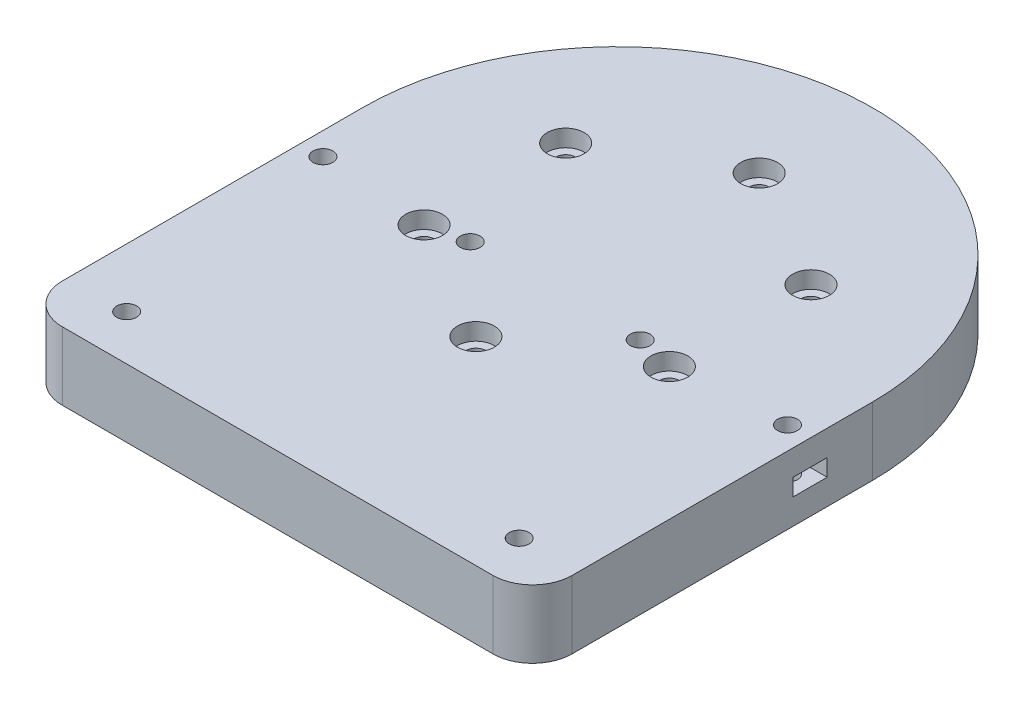
from build123d import *

# Parameters (mm, degrees)
SKETCH1_R               = 45
BOSS_EXTRUDE1_DEPTH     = 12
SKETCH2_R               = 31
CUT_EXTRUDE1_DEPTH      = 6
SKETCH3_R               = 1.75
CUT_EXTRUDE2_DEPTH      = 65.761099435
SKETCH4_R               = 3.25
CUT_EXTRUDE3_DEPTH      = 3
BOSS_EXTRUDE3_START     = -12
BOSS_EXTRUDE3_DEPTH     = 12
SKETCH7_R               = 1.75
CUT_EXTRUDE4_DEPTH      = 76.953933407
CUT_EXTRUDE5_DEPTH      = 3
CUT_EXTRUDE6_DEPTH      = 1.5
CUT_EXTRUDE6_DEPTH_BACK = 1.5
CUT_EXTRUDE7_DEPTH      = 6


with BuildPart() as part:
    # Sketch1 → Boss-Extrude1 (new body)
    with BuildSketch(Plane(origin=(0, 0, 0), x_dir=(1, 0, 0), z_dir=(0, 1, 0))):
        Circle(SKETCH1_R)
    extrude(amount=BOSS_EXTRUDE1_DEPTH)

    # Sketch2 → Cut-Extrude1 (cut)
    with BuildSketch(Plane.XZ):
        Circle(SKETCH2_R)
    extrude(amount=-CUT_EXTRUDE1_DEPTH, mode=Mode.SUBTRACT)

    # Sketch3 → Cut-Extrude2 (cut, through all)
    with BuildSketch(Plane(origin=(0, 12, 0), x_dir=(1, 0, 0), z_dir=(0, 1, 0))):
        with Locations((0, -25)):
            Circle(SKETCH3_R)
        with Locations((-21.650635095, -12.5)):
            Circle(SKETCH3_R)
        with Locations((-21.650635095, 12.5)):
            Circle(SKETCH3_R)
        with Locations((0, 25)):
            Circle(SKETCH3_R)
        with Locations((21.650635095, 12.5)):
            Circle(SKETCH3_R)
        with Locations((21.650635095, -12.5)):
            Circle(SKETCH3_R)
    extrude(amount=-CUT_EXTRUDE2_DEPTH, mode=Mode.SUBTRACT)

    # Sketch4 → Cut-Extrude3 (cut)
    with BuildSketch(Plane(origin=(0, 12, 0), x_dir=(1, 0, 0), z_dir=(0, 1, 0))):
        with Locations((0, 25)):
            Circle(SKETCH4_R)
        with Locations((21.650635095, 12.5)):
            Circle(SKETCH4_R)
        with Locations((21.650635095, -12.5)):
            Circle(SKETCH4_R)
        with Locations((0, -25)):
            Circle(SKETCH4_R)
        with Locations((-21.650635095, -12.5)):
            Circle(SKETCH4_R)
        with Locations((-21.650635095, 12.5)):
            Circle(SKETCH4_R)
    extrude(amount=-CUT_EXTRUDE3_DEPTH, mode=Mode.SUBTRACT)

    # Sketch5 → Boss-Extrude3 (add)
    with BuildSketch(Plane(origin=(0, 12, 0), x_dir=(1, 0, 0), z_dir=(0, 1, 0)).offset(BOSS_EXTRUDE3_START)):
        with BuildLine():
            ThreePointArc((45, 0), (0, -45), (-45, 0))
            Line((-45, 0), (-45, -53))
            ThreePointArc((-45, -53), (-42.949747468, -57.949747468), (-38, -60))
            Line((-38, -60), (38, -60))
            ThreePointArc((38, -60), (42.949747468, -57.949747468), (45, -53))
            Line((45, -53), (45, 0))
        make_face()
    extrude(amount=BOSS_EXTRUDE3_DEPTH)

    # Sketch7 → Cut-Extrude4 (cut, through all)
    with BuildSketch(Plane(origin=(0, 12, 0), x_dir=(1, 0, 0), z_dir=(0, 1, 0))):
        with Locations((-34.64, -52)):
            Circle(SKETCH7_R)
        with Locations((-41, -11)):
            Circle(SKETCH7_R)
        with Locations((-15, -11)):
            Circle(SKETCH7_R)
        with Locations((34.64, -52)):
            Circle(SKETCH7_R)
        with Locations((15, -11)):
            Circle(SKETCH7_R)
        with Locations((41, -11)):
            Circle(SKETCH7_R)
    extrude(amount=-CUT_EXTRUDE4_DEPTH, mode=Mode.SUBTRACT)

    # Sketch8 → Cut-Extrude5 (cut)
    with BuildSketch(Plane.XZ.offset(-6)):
        Polygon((14.23784308, 14.379218375), (11.692432582, 12.029561933), (12.454589502, 8.650343557), (15.76215692, 7.620781625), (18.307567418, 9.970438067), (17.545410498, 13.349656443), align=None)
        Polygon((-18.307567418, 9.970438067), (-17.545410498, 13.349656443), (-14.23784308, 14.379218375), (-11.692432582, 12.029561933), (-12.454589502, 8.650343557), (-15.76215692, 7.620781625), align=None)
    extrude(amount=-CUT_EXTRUDE5_DEPTH, mode=Mode.SUBTRACT)

    # Sketch9 → Cut-Extrude6 (cut, two sides: drawn at the far end of the back side and taken through both)
    with BuildSketch(Plane(origin=(0, 6, 0), x_dir=(-1, 0, 0), z_dir=(0, -1, 0)).offset(-CUT_EXTRUDE6_DEPTH_BACK)):
        Polygon((-39.267949192, -14), (-37.535898385, -11), (-39.267949192, -8), (-45, -8), (-45, -14), (-42.732050808, -14), align=None)
        Polygon((45, -14), (45, -8), (39.267949192, -8), (37.535898385, -11), (39.267949192, -14), align=None)
    extrude(amount=CUT_EXTRUDE6_DEPTH + CUT_EXTRUDE6_DEPTH_BACK, mode=Mode.SUBTRACT)

    # Sketch10 → Cut-Extrude7 (cut)
    with BuildSketch(Plane.XZ):
        Polygon((31.175898385, 52), (32.907949192, 49), (36.372050808, 49), (38.104101615, 52), (36.372050808, 55), (32.907949192, 55), align=None)
        Polygon((-32.907949192, 55), (-31.175898385, 52), (-32.907949192, 49), (-36.372050808, 49), (-38.104101615, 52), (-36.372050808, 55), align=None)
    extrude(amount=-CUT_EXTRUDE7_DEPTH, mode=Mode.SUBTRACT)


solid = part.part
